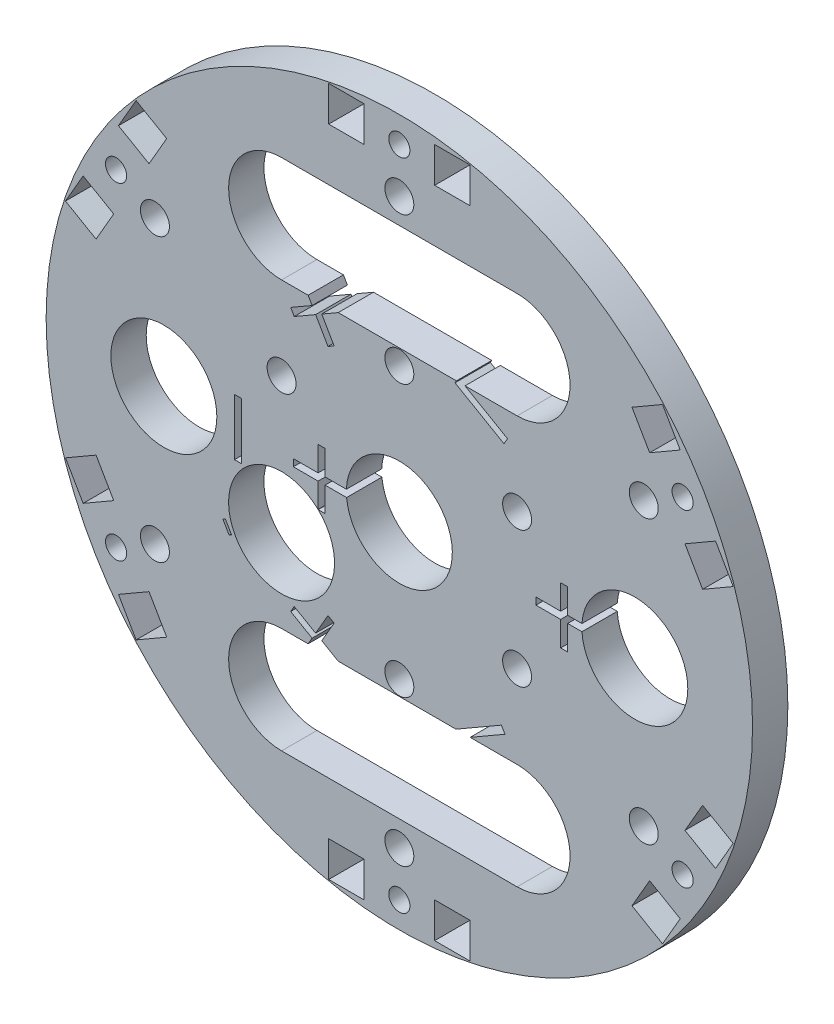
from build123d import *

# Parameters (mm, degrees)
BOSS_EXTRU_1_OUTLINE_R   = 50
BOSS_EXTRU_1_OUTLINE_W   = 5
BOSS_EXTRU_1_OUTLINE_H   = 5
BOSS_EXTRU_1_OUTLINE_R_2 = 2.05
BOSS_EXTRU_1_OUTLINE_R_3 = 1.5
BOSS_EXTRU_1_DEPTH       = 5
SKETCH3_W                = 1
SKETCH3_H                = 8
CUT_EXTRUDE2_DEPTH       = 10
SKETCH4_R                = 7.5
CUT_EXTRUDE3_DEPTH       = 10


# Read off the part's stored shape, not the designer's step: Boss.-Extru.1
with BuildPart() as part:
    # Boss.-Extru.1 outline → Boss.-Extru.1 (new body)
    with BuildSketch(Plane.XY):
        Circle(BOSS_EXTRU_1_OUTLINE_R)
        Polygon((-37.262039705, -33.060254038), (-39.762039705, -28.730127019), (-35.431912686, -26.230127019), (-32.931912686, -30.560254038), align=None, mode=Mode.SUBTRACT)
        with Locations((-7.5, -46.3)):
            Rectangle(BOSS_EXTRU_1_OUTLINE_W, BOSS_EXTRU_1_OUTLINE_H, mode=Mode.SUBTRACT)
        with Locations((-16.666666667, -28.867513459)):
            Circle(BOSS_EXTRU_1_OUTLINE_R_2, mode=Mode.SUBTRACT)
        with Locations((-40.096976195, -23.15)):
            Circle(BOSS_EXTRU_1_OUTLINE_R_3, mode=Mode.SUBTRACT)
        Polygon((-42.931912686, -13.239745962), (-40.431912686, -17.569872981), (-44.762039705, -20.069872981), (-47.262039705, -15.739745962), align=None, mode=Mode.SUBTRACT)
        with Locations((-34.597845014, -19.975075132)):
            Circle(BOSS_EXTRU_1_OUTLINE_R_2, mode=Mode.SUBTRACT)
        with Locations((-16.671397033, -9.625235564)):
            Circle(BOSS_EXTRU_1_OUTLINE_R_2, mode=Mode.SUBTRACT)
        with Locations((0, -46.3)):
            Circle(BOSS_EXTRU_1_OUTLINE_R_3, mode=Mode.SUBTRACT)
        with Locations((7.5, -46.3)):
            Rectangle(BOSS_EXTRU_1_OUTLINE_W, BOSS_EXTRU_1_OUTLINE_H, mode=Mode.SUBTRACT)
        with Locations((0, -39.950150265)):
            Circle(BOSS_EXTRU_1_OUTLINE_R_2, mode=Mode.SUBTRACT)
        with Locations((16.666666667, -28.867513459)):
            Circle(BOSS_EXTRU_1_OUTLINE_R_2, mode=Mode.SUBTRACT)
        Polygon((32.931912686, -30.560254038), (35.431912686, -26.230127019), (39.762039705, -28.730127019), (37.262039705, -33.060254038), align=None, mode=Mode.SUBTRACT)
        with Locations((0, -19.232757636)):
            Circle(BOSS_EXTRU_1_OUTLINE_R_2, mode=Mode.SUBTRACT)
        with Locations((16.666666667, -9.622504487)):
            Circle(BOSS_EXTRU_1_OUTLINE_R_2, mode=Mode.SUBTRACT)
        with Locations((34.597845014, -19.975075132)):
            Circle(BOSS_EXTRU_1_OUTLINE_R_2, mode=Mode.SUBTRACT)
        with Locations((40.096976195, -23.15)):
            Circle(BOSS_EXTRU_1_OUTLINE_R_3, mode=Mode.SUBTRACT)
        Polygon((47.262039705, -15.739745962), (44.762039705, -20.069872981), (40.431912686, -17.569872981), (42.931912686, -13.239745962), align=None, mode=Mode.SUBTRACT)
        with Locations((-33.333333333, 0)):
            Circle(BOSS_EXTRU_1_OUTLINE_R_2, mode=Mode.SUBTRACT)
        Polygon((-47.262039705, 15.739745962), (-44.762039705, 20.069872981), (-40.431912686, 17.569872981), (-42.931912686, 13.239745962), align=None, mode=Mode.SUBTRACT)
        with Locations((-40.096976195, 23.15)):
            Circle(BOSS_EXTRU_1_OUTLINE_R_3, mode=Mode.SUBTRACT)
        with Locations((-34.597845014, 19.975075132)):
            Circle(BOSS_EXTRU_1_OUTLINE_R_2, mode=Mode.SUBTRACT)
        with Locations((-16.671397032, 9.625235564)):
            Circle(BOSS_EXTRU_1_OUTLINE_R_2, mode=Mode.SUBTRACT)
        Polygon((-32.931912686, 30.560254038), (-35.431912686, 26.230127019), (-39.762039705, 28.730127019), (-37.262039705, 33.060254038), align=None, mode=Mode.SUBTRACT)
        with Locations((-16.666666667, 28.867513459)):
            Circle(BOSS_EXTRU_1_OUTLINE_R_2, mode=Mode.SUBTRACT)
        with Locations((-7.5, 46.3)):
            Rectangle(BOSS_EXTRU_1_OUTLINE_W, BOSS_EXTRU_1_OUTLINE_H, mode=Mode.SUBTRACT)
        Circle(BOSS_EXTRU_1_OUTLINE_R_2, mode=Mode.SUBTRACT)
        with Locations((16.669571796, 9.624181764)):
            Circle(BOSS_EXTRU_1_OUTLINE_R_2, mode=Mode.SUBTRACT)
        with Locations((0, 19.165334425)):
            Circle(BOSS_EXTRU_1_OUTLINE_R_2, mode=Mode.SUBTRACT)
        with Locations((33.333333333, 0)):
            Circle(BOSS_EXTRU_1_OUTLINE_R_2, mode=Mode.SUBTRACT)
        with Locations((34.597845014, 19.975075133)):
            Circle(BOSS_EXTRU_1_OUTLINE_R_2, mode=Mode.SUBTRACT)
        Polygon((42.931912686, 13.239745962), (40.431912686, 17.569872981), (44.762039705, 20.069872981), (47.262039705, 15.739745962), align=None, mode=Mode.SUBTRACT)
        with Locations((40.096976195, 23.15)):
            Circle(BOSS_EXTRU_1_OUTLINE_R_3, mode=Mode.SUBTRACT)
        with Locations((16.666666667, 28.867513459)):
            Circle(BOSS_EXTRU_1_OUTLINE_R_2, mode=Mode.SUBTRACT)
        with Locations((0, 39.950150265)):
            Circle(BOSS_EXTRU_1_OUTLINE_R_2, mode=Mode.SUBTRACT)
        with Locations((0, 46.3)):
            Circle(BOSS_EXTRU_1_OUTLINE_R_3, mode=Mode.SUBTRACT)
        with Locations((7.5, 46.3)):
            Rectangle(BOSS_EXTRU_1_OUTLINE_W, BOSS_EXTRU_1_OUTLINE_H, mode=Mode.SUBTRACT)
        Polygon((37.262039705, 33.060254038), (39.762039705, 28.730127019), (35.431912686, 26.230127019), (32.931912686, 30.560254038), align=None, mode=Mode.SUBTRACT)
    extrude(amount=BOSS_EXTRU_1_DEPTH)

    # Sketch3 → Cut-Extrude2 (cut)
    with BuildSketch(Plane.XY.offset(5)):
        with Locations((-22.833333333, 0)):
            Rectangle(SKETCH3_W, SKETCH3_H)
        Polygon((-13.233653965, 23.921361037), (-14.099679369, 23.421361037), (-12.349679369, 20.390272124), (-15.380768282, 18.640272124), (-14.880768282, 17.77424672), (-11.849679369, 19.52424672), (-10.099679369, 16.493157806), (-9.233653965, 16.993157806), (-10.983653965, 20.02424672), (-7.952565052, 21.77424672), (-8.452565052, 22.640272124), (-11.483653965, 20.890272124), align=None)
        Polygon((15.311458483, 17.894294813), (14.811458483, 17.028269409), (7.883255253, 21.028269409), (8.383255253, 21.894294813), align=None)
        Polygon((8.02187485, -22.52022403), (7.52187485, -21.654198627), (14.450078081, -17.654198627), (14.950078081, -18.52022403), align=None)
        Polygon((27.333333333, -0.5), (27.333333333, 0.5), (23.833333333, 0.5), (23.833333333, 4), (22.833333333, 4), (22.833333333, 0.5), (19.333333333, 0.5), (19.333333333, -0.5), (22.833333333, -0.5), (22.833333333, -4), (23.833333333, -4), (23.833333333, -0.5), align=None)
        Polygon((-14.099679369, -23.421361037), (-13.233653965, -23.921361037), (-11.483653965, -20.890272124), (-8.452565052, -22.640272124), (-7.952565052, -21.77424672), (-10.983653965, -20.02424672), (-9.233653965, -16.993157806), (-10.099679369, -16.493157806), (-11.849679369, -19.52424672), (-14.880768282, -17.77424672), (-15.380768282, -18.640272124), (-12.349679369, -20.390272124), align=None)
        Polygon((-7.005935602, -0.708643072), (-7.005935602, 0.291356928), (-10.505935602, 0.291356928), (-10.505935602, 3.791356928), (-11.505935602, 3.791356928), (-11.505935602, 0.291356928), (-15.005935602, 0.291356928), (-15.005935602, -0.708643072), (-11.505935602, -0.708643072), (-11.505935602, -4.208643072), (-10.505935602, -4.208643072), (-10.505935602, -0.708643072), align=None)
        Polygon((-24.636137397, -11.902985286), (-23.7450767, -13.444692017), (-24.087572192, -13.64217549), (-24.97863289, -12.100468759), align=None)
    extrude(amount=-CUT_EXTRUDE2_DEPTH, mode=Mode.SUBTRACT)

    # Sketch4 → Cut-Extrude3 (cut)
    with BuildSketch(Plane(origin=(0, 0, 0), x_dir=(-1, 0, 0), z_dir=(0, 0, -1))):
        with Locations((-33.333333333, 0)):
            Circle(SKETCH4_R)
        Circle(SKETCH4_R)
        with Locations((33.333333333, 0)):
            Circle(SKETCH4_R)
        with Locations((16.671397033, -9.625235564)):
            Circle(SKETCH4_R)
        with BuildLine():
            Line((16.666666667, -36.367513459), (-16.666666667, -36.367513459))
            ThreePointArc((-16.666666667, -36.367513459), (-24.166666667, -28.867513459), (-16.666666667, -21.367513459))
            Line((-16.666666667, -21.367513459), (16.666666667, -21.367513459))
            ThreePointArc((16.666666667, -21.367513459), (24.166666667, -28.867513459), (16.666666667, -36.367513459))
        make_face()
        with BuildLine():
            Line((-16.666666667, 36.367513459), (16.666666667, 36.367513459))
            ThreePointArc((16.666666667, 36.367513459), (24.166666667, 28.867513459), (16.666666667, 21.367513459))
            Line((16.666666667, 21.367513459), (-16.666666667, 21.367513459))
            ThreePointArc((-16.666666667, 21.367513459), (-24.166666667, 28.867513459), (-16.666666667, 36.367513459))
        make_face()
    extrude(amount=-CUT_EXTRUDE3_DEPTH, mode=Mode.SUBTRACT)


with BuildPart() as cut_extrude3_kept_piece:
    # of the separate pieces the step leaves, the one the design keeps (cut_extrude3_pieces_kept)
    add(part.part.solids().sort_by_distance((50, 0, 0))[0])


solid = cut_extrude3_kept_piece.part
